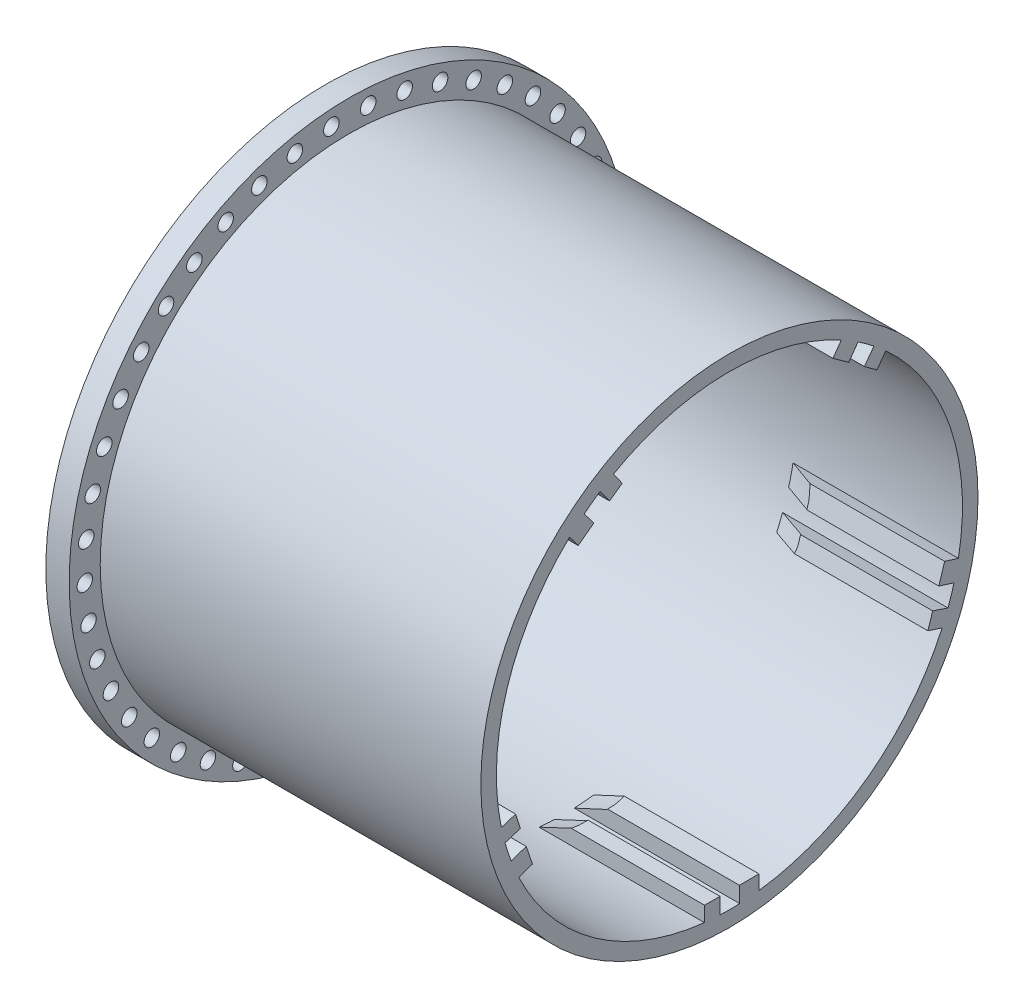
from build123d import *

# Parameters (mm, degrees)
SKETCH1_R           = 36
SKETCH1_R_2         = 1
SKETCH1_R_3         = 4.25
BOSS_EXTRUDE1_DEPTH = 3
SKETCH2_R           = 32
BOSS_EXTRUDE4_DEPTH = 49
SKETCH1_7_R         = 30
CUT_EXTRUDE3_DEPTH  = 3
CUT_EXTRUDE4_START  = -17
SKETCH3_R           = 30
CUT_EXTRUDE4_DEPTH  = 56.773621595
CHAMFER2_SIZE       = 4.289013841
CHAMFER2_SIZE_2     = 2


with BuildPart() as part:
    # Sketch1 → Boss-Extrude1 (new body)
    with BuildSketch(Plane(origin=(0, 0, 0), x_dir=(0, 0, -1), z_dir=(1, 0, 0))):
        Circle(SKETCH1_R)
        with Locations((20.089039043, 27.430466826)):
            Circle(SKETCH1_R_2, mode=Mode.SUBTRACT)
        with Locations((23.711117025, 24.36766155)):
            Circle(SKETCH1_R_2, mode=Mode.SUBTRACT)
        with Locations((26.871685085, 20.830567459)):
            Circle(SKETCH1_R_2, mode=Mode.SUBTRACT)
        with Locations((29.509226361, 16.888030067)):
            Circle(SKETCH1_R_2, mode=Mode.SUBTRACT)
        with Locations((31.572404113, 12.61678638)):
            Circle(SKETCH1_R_2, mode=Mode.SUBTRACT)
        with Locations((33.021060931, 8.099971297)):
            Circle(SKETCH1_R_2, mode=Mode.SUBTRACT)
        with Locations((33.827000359, 3.425499486)):
            Circle(SKETCH1_R_2, mode=Mode.SUBTRACT)
        with Locations((33.974535702, -1.315645775)):
            Circle(SKETCH1_R_2, mode=Mode.SUBTRACT)
        with Locations((33.460795354, -6.031183488)):
            Circle(SKETCH1_R_2, mode=Mode.SUBTRACT)
        with Locations((32.295778685, -10.629331075)):
            Circle(SKETCH1_R_2, mode=Mode.SUBTRACT)
        with Locations((30.50216142, -15.020590824)):
            Circle(SKETCH1_R_2, mode=Mode.SUBTRACT)
        with Locations((28.114854279, -19.119491857)):
            Circle(SKETCH1_R_2, mode=Mode.SUBTRACT)
        with Locations((25.180323479, -22.84625373)):
            Circle(SKETCH1_R_2, mode=Mode.SUBTRACT)
        with Locations((21.755686325, -26.128339261)):
            Circle(SKETCH1_R_2, mode=Mode.SUBTRACT)
        with Locations((17.907599484, -28.901866388)):
            Circle(SKETCH1_R_2, mode=Mode.SUBTRACT)
        with Locations((13.710961588, -31.112851562)):
            Circle(SKETCH1_R_2, mode=Mode.SUBTRACT)
        with Locations((9.24745542, -32.718260471)):
            Circle(SKETCH1_R_2, mode=Mode.SUBTRACT)
        with Locations((4.603958052, -33.686845656)):
            Circle(SKETCH1_R_2, mode=Mode.SUBTRACT)
        with Locations((-0.129150123, -33.999754709)):
            Circle(SKETCH1_R_2, mode=Mode.SUBTRACT)
        with Locations((-4.859744537, -33.65089721)):
            Circle(SKETCH1_R_2, mode=Mode.SUBTRACT)
        with Locations((-9.495749552, -32.647063274)):
            Circle(SKETCH1_R_2, mode=Mode.SUBTRACT)
        with Locations((-13.946930604, -31.007791388)):
            Circle(SKETCH1_R_2, mode=Mode.SUBTRACT)
        with Locations((-18.126650515, -28.764988112)):
            Circle(SKETCH1_R_2, mode=Mode.SUBTRACT)
        with Locations((-21.953555793, -25.962307063)):
            Circle(SKETCH1_R_2, mode=Mode.SUBTRACT)
        with Locations((-25.353160079, -22.654299239)):
            Circle(SKETCH1_R_2, mode=Mode.SUBTRACT)
        with Locations((-28.259293943, -18.905351249)):
            Circle(SKETCH1_R_2, mode=Mode.SUBTRACT)
        with Locations((-30.615392795, -14.788432101)):
            Circle(SKETCH1_R_2, mode=Mode.SUBTRACT)
        with Locations((-32.375597851, -10.383672944)):
            Circle(SKETCH1_R_2, mode=Mode.SUBTRACT)
        with Locations((-33.505648721, -5.776807404)):
            Circle(SKETCH1_R_2, mode=Mode.SUBTRACT)
        with Locations((-33.983550251, -1.057502879)):
            Circle(SKETCH1_R_2, mode=Mode.SUBTRACT)
        with Locations((-33.800000631, 3.682384736)):
            Circle(SKETCH1_R_2, mode=Mode.SUBTRACT)
        with Locations((-32.958572446, 8.350598921)):
            Circle(SKETCH1_R_2, mode=Mode.SUBTRACT)
        with Locations((-31.475643138, 12.856278197)):
            Circle(SKETCH1_R_2, mode=Mode.SUBTRACT)
        with Locations((-29.380076239, 17.111724641)):
            Circle(SKETCH1_R_2, mode=Mode.SUBTRACT)
        with Locations((-26.712659575, 21.03411083)):
            Circle(SKETCH1_R_2, mode=Mode.SUBTRACT)
        with Locations((-23.525311378, 24.547091977)):
            Circle(SKETCH1_R_2, mode=Mode.SUBTRACT)
        with Locations((-19.880069755, 27.582291901)):
            Circle(SKETCH1_R_2, mode=Mode.SUBTRACT)
        with Locations((-15.847885187, 30.080633888)):
            Circle(SKETCH1_R_2, mode=Mode.SUBTRACT)
        with Locations((-11.507239561, 31.993490552)):
            Circle(SKETCH1_R_2, mode=Mode.SUBTRACT)
        with Locations((-6.942618606, 33.283630314)):
            Circle(SKETCH1_R_2, mode=Mode.SUBTRACT)
        with Locations((-2.242867477, 33.925942072)):
            Circle(SKETCH1_R_2, mode=Mode.SUBTRACT)
        with Locations((2.500538516, 33.907923958)):
            Circle(SKETCH1_R_2, mode=Mode.SUBTRACT)
        with Locations((7.195274371, 33.229926673)):
            Circle(SKETCH1_R_2, mode=Mode.SUBTRACT)
        with Locations((11.749962396, 31.905146665)):
            Circle(SKETCH1_R_2, mode=Mode.SUBTRACT)
        with Locations((16.075950767, 29.959369268)):
            Circle(SKETCH1_R_2, mode=Mode.SUBTRACT)
        Circle(SKETCH1_R_3, mode=Mode.SUBTRACT)
    extrude(amount=BOSS_EXTRUDE1_DEPTH)

    # Sketch2 → Boss-Extrude4 (add)
    with BuildSketch(Plane(origin=(3, 0, 0), x_dir=(0, 0, -1), z_dir=(1, 0, 0))):
        Circle(SKETCH2_R)
        with BuildLine():
            ThreePointArc((3.814407208, -29.756516894), (17.876251009, -24.092315162), (27.373321967, -12.276043519))
            Line((27.373321967, -12.276043519), (25.537181456, -11.665738199))
            Line((25.537181456, -11.665738199), (26.168016669, -9.767832265))
            Line((26.168016669, -9.767832265), (28.13201636, -10.420636042))
            ThreePointArc((28.13201636, -10.420636042), (28.546970251, -9.223366495), (28.910995043, -8.009642041))
            Line((28.910995043, -8.009642041), (26.956560685, -7.395449847))
            Line((26.956560685, -7.395449847), (27.70606209, -5.0104451))
            Line((27.70606209, -5.0104451), (29.478845945, -5.567552583))
            ThreePointArc((29.478845945, -5.567552583), (28.437218685, 9.55639019), (20.134032864, 22.240070158))
            Line((20.134032864, 22.240070158), (18.98619939, 20.682391476))
            Line((18.98619939, 20.682391476), (17.376122385, 21.868836603))
            Line((17.376122385, 21.868836603), (18.603884953, 23.534983846))
            ThreePointArc((18.603884953, 23.534983846), (17.593441753, 24.299605085), (16.551611049, 25.020874719))
            Line((16.551611049, 25.020874719), (15.363526129, 23.351893012))
            Line((15.363526129, 23.351893012), (13.326860495, 24.801718206))
            Line((13.326860495, 24.801718206), (14.404521535, 26.315580164))
            ThreePointArc((14.404521535, 26.315580164), (-0.301083316, 29.998489109), (-14.929805327, 26.021162789))
            Line((-14.929805327, 26.021162789), (-13.803064916, 24.4481591))
            Line((-13.803064916, 24.4481591), (-15.428982442, 23.28351658))
            Line((-15.428982442, 23.28351658), (-16.634183136, 24.966055984))
            ThreePointArc((-16.634183136, 24.966055984), (-17.673625268, 24.241348351), (-18.681536846, 23.473393045))
            Line((-18.681536846, 23.473393045), (-17.46137935, 21.82771343))
            Line((-17.46137935, 21.82771343), (-19.469609341, 20.338749931))
            Line((-19.469609341, 20.338749931), (-20.576362045, 21.831475557))
            ThreePointArc((-20.576362045, 21.831475557), (-28.623298408, 8.983695691), (-29.361160001, -6.158107128))
            Line((-29.361160001, -6.158107128), (-27.516962657, -5.57259819))
            Line((-27.516962657, -5.57259819), (-26.911757946, -7.478831979))
            Line((-26.911757946, -7.478831979), (-28.884375506, -8.105112683))
            ThreePointArc((-28.884375506, -8.105112683), (-28.516342873, -9.317627871), (-28.097435782, -10.513519985))
            Line((-28.097435782, -10.513519985), (-26.155252058, -9.861624216))
            Line((-26.155252058, -9.861624216), (-25.359740815, -12.23167946))
            Line((-25.359740815, -12.23167946), (-27.121412643, -12.822986245))
            ThreePointArc((-27.121412643, -12.822986245), (-17.38908797, -24.446259828), (-3.216389503, -29.827082301))
            Line((-3.216389503, -29.827082301), (-3.203353273, -27.892214187))
            Line((-3.203353273, -27.892214187), (-1.203398666, -27.905688939))
            Line((-1.203398666, -27.905688939), (-1.217342671, -29.975291105))
            ThreePointArc((-1.217342671, -29.975291105), (0.049556138, -29.99995907), (1.316366536, -29.971105738))
            Line((1.316366536, -29.971105738), (1.296544593, -27.92253238))
            Line((1.296544593, -27.92253238), (3.796427571, -27.898343577))
            Line((3.796427571, -27.898343577), (3.814407208, -29.756516894))
        make_face(mode=Mode.SUBTRACT)
    extrude(amount=BOSS_EXTRUDE4_DEPTH)

    # Sketch1<7> → Cut-Extrude3 (cut)
    with BuildSketch(Plane(origin=(0, 0, 0), x_dir=(0, 0, -1), z_dir=(1, 0, 0))):
        with Locations(Location((0, 0, 0), (0, 0, 191.845318953))):
            Circle(SKETCH1_7_R)
    extrude(amount=CUT_EXTRUDE3_DEPTH, mode=Mode.SUBTRACT)

    # Sketch3 → Cut-Extrude4 (cut, through all)
    with BuildSketch(Plane(origin=(52, 0, 0), x_dir=(0, 0, -1), z_dir=(1, 0, 0)).offset(CUT_EXTRUDE4_START)):
        with Locations(Location((0, 0, 0), (0, 0, 191.845318953))):
            Circle(SKETCH3_R)
    extrude(amount=-CUT_EXTRUDE4_DEPTH, mode=Mode.SUBTRACT)

    # Chamfer2
    # the kernel refuses this chamfer: 4.289013841, 2 mm, written as the material it adds along each edge
    with BuildSketch(Plane(origin=(35, 0, 0), x_dir=(0, -0.9471605084793957, 0.3207599899879229), z_dir=(0, 0.3207599899879229, 0.9471605084793957))) as chamfer2_piece_1_section:
        Polygon((30, -CHAMFER2_SIZE), (30 - CHAMFER2_SIZE_2, 0), (30, 0), align=None)
    chamfer2_piece_1 = revolve(axis=Axis((35, 0, 0), (1, 0, 0)), revolution_arc=47.237420401, mode=Mode.PRIVATE)
    chamfer2_piece_1 = split(chamfer2_piece_1, bisect_by=Plane(origin=(33.540854051, -27.956601206, 2.224426607), z_dir=(0, -0.9999531910488229, -0.009675521240562588)), keep=Keep.TOP, mode=Mode.PRIVATE)
    chamfer2_piece_1 = split(chamfer2_piece_1, bisect_by=Plane(origin=(33.540854051, -29.29435355, 1.212754834), z_dir=(0, 0.006737376227867174, 0.9999773036232193)), keep=Keep.TOP, mode=Mode.PRIVATE)
    chamfer2_piece_1 = split(chamfer2_piece_1, bisect_by=Plane(origin=(33.540854051, -29.280878798, 3.212709441), z_dir=(0, -0.006737376227861118, -0.9999773036232195)), keep=Keep.TOP, mode=Mode.PRIVATE)
    add(chamfer2_piece_1)
    with BuildSketch(Plane(origin=(35, 0, 0), x_dir=(0, -0.9471605084793957, 0.3207599899879229), z_dir=(0, 0.3207599899879229, 0.9471605084793957))) as chamfer2_piece_2_section:
        Polygon((30, -CHAMFER2_SIZE), (30 - CHAMFER2_SIZE_2, 0), (30, 0), align=None)
    chamfer2_piece_2 = revolve(axis=Axis((35, 0, 0), (1, 0, 0)), revolution_arc=47.237420401, mode=Mode.PRIVATE)
    chamfer2_piece_2 = split(chamfer2_piece_2, bisect_by=Plane(origin=(35.059461893, -27.959086514, 2.481280129), z_dir=(0, 0.9999531910488229, 0.009675521240562588)), keep=Keep.TOP, mode=Mode.PRIVATE)
    chamfer2_piece_2 = split(chamfer2_piece_2, bisect_by=Plane(origin=(35.059461893, -27.938747432, 1.203621398), z_dir=(0, 0.006737376227867174, 0.9999773036232193)), keep=Keep.TOP, mode=Mode.PRIVATE)
    chamfer2_piece_2 = split(chamfer2_piece_2, bisect_by=Plane(origin=(35.059461893, -27.92527268, 3.203576005), z_dir=(0, -0.006737376227861118, -0.9999773036232195)), keep=Keep.TOP, mode=Mode.PRIVATE)
    chamfer2_piece_2 = split(chamfer2_piece_2, bisect_by=Plane(origin=(35.059461893, -27.897078789, 2.481337509), z_dir=(0, -0.9999773036232195, 0.0067373762278606295)), keep=Keep.TOP, mode=Mode.PRIVATE)
    add(chamfer2_piece_2)
    with BuildSketch(Plane(origin=(35, 0, 0), x_dir=(0, -0.9471605084793957, 0.3207599899879229), z_dir=(0, 0.3207599899879229, 0.9471605084793957))) as chamfer2_piece_3_section:
        Polygon((30, -CHAMFER2_SIZE), (30 - CHAMFER2_SIZE_2, 0), (30, 0), align=None)
    chamfer2_piece_3 = revolve(axis=Axis((35, 0, 0), (1, 0, 0)), revolution_arc=47.237420401, mode=Mode.PRIVATE)
    chamfer2_piece_3 = split(chamfer2_piece_3, bisect_by=Plane(origin=(33.539564686, -29.24525833, -3.809460283), z_dir=(0, -0.009675521240564857, 0.9999531910488229)), keep=Keep.TOP, mode=Mode.PRIVATE)
    chamfer2_piece_3 = split(chamfer2_piece_3, bisect_by=Plane(origin=(33.539564686, -29.269447133, -1.309577306), z_dir=(0, 0.009675521240554133, -0.9999531910488229)), keep=Keep.TOP, mode=Mode.PRIVATE)
    chamfer2_piece_3 = split(chamfer2_piece_3, bisect_by=Plane(origin=(33.539564686, -27.931087014, -2.566243676), z_dir=(0, -0.9999773036232195, 0.0067373762278606295)), keep=Keep.TOP, mode=Mode.PRIVATE)
    add(chamfer2_piece_3)
    with BuildSketch(Plane(origin=(35, 0, 0), x_dir=(0, -0.9471605084793957, 0.3207599899879229), z_dir=(0, 0.3207599899879229, 0.9471605084793957))) as chamfer2_piece_4_section:
        Polygon((30, -CHAMFER2_SIZE), (30 - CHAMFER2_SIZE_2, 0), (30, 0), align=None)
    chamfer2_piece_4 = revolve(axis=Axis((35, 0, 0), (1, 0, 0)), revolution_arc=47.237420401, mode=Mode.PRIVATE)
    chamfer2_piece_4 = split(chamfer2_piece_4, bisect_by=Plane(origin=(34.994576269, -27.913778513, -3.796576919), z_dir=(0, -0.009675521240564857, 0.9999531910488229)), keep=Keep.TOP, mode=Mode.PRIVATE)
    chamfer2_piece_4 = split(chamfer2_piece_4, bisect_by=Plane(origin=(34.994576269, -27.904749848, -3.134347345), z_dir=(0, -0.9999531910488229, -0.009675521240562588)), keep=Keep.TOP, mode=Mode.PRIVATE)
    chamfer2_piece_4 = split(chamfer2_piece_4, bisect_by=Plane(origin=(34.994576269, -27.934914967, -3.134397448), z_dir=(0, 0.9999773036232195, -0.0067373762278606295)), keep=Keep.TOP, mode=Mode.PRIVATE)
    add(chamfer2_piece_4)
    with BuildSketch(Plane(origin=(35, 0, 0), x_dir=(0, 0.012372185123805581, 0.9999234615885669), z_dir=(0, 0.9999234615885669, -0.012372185123805581))) as chamfer2_piece_5_section:
        Polygon((30, -CHAMFER2_SIZE), (30 - CHAMFER2_SIZE_2, 0), (30, 0), align=None)
    chamfer2_piece_5 = revolve(axis=Axis((35, 0, 0), (1, 0, 0)), revolution_arc=47.237420401, mode=Mode.PRIVATE)
    chamfer2_piece_5 = split(chamfer2_piece_5, bisect_by=Plane(origin=(33.540854051, -6.523509458, 27.275693375), z_dir=(0, -0.3182044971379357, 0.9480220978443453)), keep=Keep.TOP, mode=Mode.PRIVATE)
    chamfer2_piece_5 = split(chamfer2_piece_5, bisect_by=Plane(origin=(33.540854051, -7.899054699, 28.235347688), z_dir=(0, 0.9531168945100278, 0.3026023552445694)), keep=Keep.TOP, mode=Mode.PRIVATE)
    chamfer2_piece_5 = split(chamfer2_piece_5, bisect_by=Plane(origin=(33.540854051, -5.99282091, 28.840552399), z_dir=(0, -0.9531168945100277, -0.3026023552445699)), keep=Keep.TOP, mode=Mode.PRIVATE)
    add(chamfer2_piece_5)
    with BuildSketch(Plane(origin=(35, 0, 0), x_dir=(0, 0.012372185123805581, 0.9999234615885669), z_dir=(0, 0.9999234615885669, -0.012372185123805581))) as chamfer2_piece_6_section:
        Polygon((30, -CHAMFER2_SIZE), (30 - CHAMFER2_SIZE_2, 0), (30, 0), align=None)
    chamfer2_piece_6 = revolve(axis=Axis((35, 0, 0), (1, 0, 0)), revolution_arc=47.237420401, mode=Mode.PRIVATE)
    chamfer2_piece_6 = split(chamfer2_piece_6, bisect_by=Plane(origin=(35.059461893, -6.279995244, 27.357429147), z_dir=(0, 0.3182044971379357, -0.9480220978443453)), keep=Keep.TOP, mode=Mode.PRIVATE)
    chamfer2_piece_6 = split(chamfer2_piece_6, bisect_by=Plane(origin=(35.059461893, -7.488835784, 26.943267269), z_dir=(0, 0.9531168945100278, 0.3026023552445694)), keep=Keep.TOP, mode=Mode.PRIVATE)
    chamfer2_piece_6 = split(chamfer2_piece_6, bisect_by=Plane(origin=(35.059461893, -5.582601995, 27.54847198), z_dir=(0, -0.9531168945100277, -0.3026023552445699)), keep=Keep.TOP, mode=Mode.PRIVATE)
    chamfer2_piece_6 = split(chamfer2_piece_6, bisect_by=Plane(origin=(35.059461893, -6.260779232, 27.298474027), z_dir=(0, -0.30260235524456996, 0.9531168945100277)), keep=Keep.TOP, mode=Mode.PRIVATE)
    add(chamfer2_piece_6)
    with BuildSketch(Plane(origin=(35, 0, 0), x_dir=(0, 0.012372185123805581, 0.9999234615885669), z_dir=(0, 0.9999234615885669, -0.012372185123805581))) as chamfer2_piece_7_section:
        Polygon((30, -CHAMFER2_SIZE), (30 - CHAMFER2_SIZE_2, 0), (30, 0), align=None)
    chamfer2_piece_7 = revolve(axis=Axis((35, 0, 0), (1, 0, 0)), revolution_arc=47.237420401, mode=Mode.PRIVATE)
    chamfer2_piece_7 = split(chamfer2_piece_7, bisect_by=Plane(origin=(33.539564686, -12.660293855, 26.636705539), z_dir=(0, 0.9480220978443453, 0.3182044971379361)), keep=Keep.TOP, mode=Mode.PRIVATE)
    chamfer2_piece_7 = split(chamfer2_piece_7, bisect_by=Plane(origin=(33.539564686, -10.29023861, 27.432216781), z_dir=(0, -0.9480220978443462, -0.31820449713793325)), keep=Keep.TOP, mode=Mode.PRIVATE)
    chamfer2_piece_7 = split(chamfer2_piece_7, bisect_by=Plane(origin=(33.539564686, -11.071823329, 25.771029405), z_dir=(0, -0.30260235524456996, 0.9531168945100277)), keep=Keep.TOP, mode=Mode.PRIVATE)
    add(chamfer2_piece_7)
    with BuildSketch(Plane(origin=(35, 0, 0), x_dir=(0, 0.012372185123805581, 0.9999234615885669), z_dir=(0, 0.9999234615885669, -0.012372185123805581))) as chamfer2_piece_8_section:
        Polygon((30, -CHAMFER2_SIZE), (30 - CHAMFER2_SIZE_2, 0), (30, 0), align=None)
    chamfer2_piece_8 = revolve(axis=Axis((35, 0, 0), (1, 0, 0)), revolution_arc=47.237420401, mode=Mode.PRIVATE)
    chamfer2_piece_8 = split(chamfer2_piece_8, bisect_by=Plane(origin=(34.994576269, -12.236591156, 25.37437416), z_dir=(0, 0.9480220978443453, 0.3182044971379361)), keep=Keep.TOP, mode=Mode.PRIVATE)
    chamfer2_piece_8 = split(chamfer2_piece_8, bisect_by=Plane(origin=(34.994576269, -11.603983394, 25.570427582), z_dir=(0, -0.3182044971379357, 0.9480220978443453)), keep=Keep.TOP, mode=Mode.PRIVATE)
    chamfer2_piece_8 = split(chamfer2_piece_8, bisect_by=Plane(origin=(34.994576269, -11.613352579, 25.599100833), z_dir=(0, 0.30260235524456996, -0.9531168945100277)), keep=Keep.TOP, mode=Mode.PRIVATE)
    add(chamfer2_piece_8)
    with BuildSketch(Plane(origin=(35, 0, 0), x_dir=(0, 0.9548069394010322, 0.2972266954222545), z_dir=(0, 0.2972266954222545, -0.9548069394010322))) as chamfer2_piece_9_section:
        Polygon((30, -CHAMFER2_SIZE), (30 - CHAMFER2_SIZE_2, 0), (30, 0), align=None)
    chamfer2_piece_9 = revolve(axis=Axis((35, 0, 0), (1, 0, 0)), revolution_arc=47.237420401, mode=Mode.PRIVATE)
    chamfer2_piece_9 = split(chamfer2_piece_9, bisect_by=Plane(origin=(33.540854051, 23.924850635, 14.632878965), z_dir=(0, 0.8032919964445093, 0.5955853997943489)), keep=Keep.TOP, mode=Mode.PRIVATE)
    chamfer2_piece_9 = split(chamfer2_piece_9, bisect_by=Plane(origin=(33.540854051, 25.577111787, 14.611732196), z_dir=(0, -0.5823212598310848, 0.812958763006303)), keep=Keep.TOP, mode=Mode.PRIVATE)
    chamfer2_piece_9 = split(chamfer2_piece_9, bisect_by=Plane(origin=(33.540854051, 24.412469268, 16.237649722), z_dir=(0, 0.5823212598310827, -0.8129587630063045)), keep=Keep.TOP, mode=Mode.PRIVATE)
    add(chamfer2_piece_9)
    with BuildSketch(Plane(origin=(35, 0, 0), x_dir=(0, 0.9548069394010322, 0.2972266954222545), z_dir=(0, 0.2972266954222545, -0.9548069394010322))) as chamfer2_piece_10_section:
        Polygon((30, -CHAMFER2_SIZE), (30 - CHAMFER2_SIZE_2, 0), (30, 0), align=None)
    chamfer2_piece_10 = revolve(axis=Axis((35, 0, 0), (1, 0, 0)), revolution_arc=47.237420401, mode=Mode.PRIVATE)
    chamfer2_piece_10 = split(chamfer2_piece_10, bisect_by=Plane(origin=(35.059461893, 24.077836004, 14.426540928), z_dir=(0, -0.8032919964445093, -0.5955853997943489)), keep=Keep.TOP, mode=Mode.PRIVATE)
    chamfer2_piece_10 = split(chamfer2_piece_10, bisect_by=Plane(origin=(35.059461893, 24.475034901, 13.822316016), z_dir=(0, -0.5823212598310848, 0.812958763006303)), keep=Keep.TOP, mode=Mode.PRIVATE)
    chamfer2_piece_10 = split(chamfer2_piece_10, bisect_by=Plane(origin=(35.059461893, 24.027704427, 14.390047281), z_dir=(0, 0.8129587630063031, 0.5823212598310847)), keep=Keep.TOP, mode=Mode.PRIVATE)
    chamfer2_piece_10 = split(chamfer2_piece_10, bisect_by=Plane(origin=(35.059461893, 23.310392381, 15.448233542), z_dir=(0, 0.5823212598310827, -0.8129587630063045)), keep=Keep.TOP, mode=Mode.PRIVATE)
    add(chamfer2_piece_10)
    with BuildSketch(Plane(origin=(35, 0, 0), x_dir=(0, 0.9548069394010322, 0.2972266954222545), z_dir=(0, 0.2972266954222545, -0.9548069394010322))) as chamfer2_piece_11_section:
        Polygon((30, -CHAMFER2_SIZE), (30 - CHAMFER2_SIZE_2, 0), (30, 0), align=None)
    chamfer2_piece_11 = revolve(axis=Axis((35, 0, 0), (1, 0, 0)), revolution_arc=47.237420401, mode=Mode.PRIVATE)
    chamfer2_piece_11 = split(chamfer2_piece_11, bisect_by=Plane(origin=(33.539564686, 21.42076642, 20.271849655), z_dir=(0, 0.5955853997943487, -0.8032919964445098)), keep=Keep.TOP, mode=Mode.PRIVATE)
    chamfer2_piece_11 = split(chamfer2_piece_11, bisect_by=Plane(origin=(33.539564686, 22.90972992, 18.263619663), z_dir=(0, -0.5955853997943481, 0.80329199644451)), keep=Keep.TOP, mode=Mode.PRIVATE)
    chamfer2_piece_11 = split(chamfer2_piece_11, bisect_by=Plane(origin=(33.539564686, 21.088323879, 18.493615773), z_dir=(0, 0.8129587630063031, 0.5823212598310847)), keep=Keep.TOP, mode=Mode.PRIVATE)
    add(chamfer2_piece_11)
    with BuildSketch(Plane(origin=(35, 0, 0), x_dir=(0, 0.9548069394010322, 0.2972266954222545), z_dir=(0, 0.2972266954222545, -0.9548069394010322))) as chamfer2_piece_12_section:
        Polygon((30, -CHAMFER2_SIZE), (30 - CHAMFER2_SIZE_2, 0), (30, 0), align=None)
    chamfer2_piece_12 = revolve(axis=Axis((35, 0, 0), (1, 0, 0)), revolution_arc=47.237420401, mode=Mode.PRIVATE)
    chamfer2_piece_12 = split(chamfer2_piece_12, bisect_by=Plane(origin=(34.994576269, 20.351149272, 19.478802594), z_dir=(0, 0.5955853997943487, -0.8032919964445098)), keep=Keep.TOP, mode=Mode.PRIVATE)
    chamfer2_piece_12 = split(chamfer2_piece_12, bisect_by=Plane(origin=(34.994576269, 20.733093706, 18.937740698), z_dir=(0, 0.8032919964445093, 0.5955853997943489)), keep=Keep.TOP, mode=Mode.PRIVATE)
    chamfer2_piece_12 = split(chamfer2_piece_12, bisect_by=Plane(origin=(34.994576269, 20.75746835, 18.955511844), z_dir=(0, -0.8129587630063031, -0.5823212598310847)), keep=Keep.TOP, mode=Mode.PRIVATE)
    add(chamfer2_piece_12)
    with BuildSketch(Plane(origin=(35, 0, 0), x_dir=(0, 0.5777309561202609, -0.8162272614537994), z_dir=(0, -0.8162272614537994, -0.5777309561202609))) as chamfer2_piece_13_section:
        Polygon((30, -CHAMFER2_SIZE), (30 - CHAMFER2_SIZE_2, 0), (30, 0), align=None)
    chamfer2_piece_13 = revolve(axis=Axis((35, 0, 0), (1, 0, 0)), revolution_arc=47.237420401, mode=Mode.PRIVATE)
    chamfer2_piece_13 = split(chamfer2_piece_13, bisect_by=Plane(origin=(33.540854051, 21.309880326, -18.232076821), z_dir=(0, 0.814666253831402, -0.5799300775682442)), keep=Keep.TOP, mode=Mode.PRIVATE)
    chamfer2_piece_13 = split(chamfer2_piece_13, bisect_by=Plane(origin=(33.540854051, 21.800345328, -19.810005268), z_dir=(0, 0.5932225635627563, 0.8050385022345401)), keep=Keep.TOP, mode=Mode.PRIVATE)
    chamfer2_piece_13 = split(chamfer2_piece_13, bisect_by=Plane(origin=(33.540854051, 22.986790455, -18.199928263), z_dir=(0, -0.5932225635627612, -0.8050385022345365)), keep=Keep.TOP, mode=Mode.PRIVATE)
    add(chamfer2_piece_13)
    with BuildSketch(Plane(origin=(35, 0, 0), x_dir=(0, 0.5777309561202609, -0.8162272614537994), z_dir=(0, -0.8162272614537994, -0.5777309561202609))) as chamfer2_piece_14_section:
        Polygon((30, -CHAMFER2_SIZE), (30 - CHAMFER2_SIZE_2, 0), (30, 0), align=None)
    chamfer2_piece_14 = revolve(axis=Axis((35, 0, 0), (1, 0, 0)), revolution_arc=47.237420401, mode=Mode.PRIVATE)
    chamfer2_piece_14 = split(chamfer2_piece_14, bisect_by=Plane(origin=(35.059461893, 21.16091627, -18.441336513), z_dir=(0, -0.814666253831402, 0.5799300775682442)), keep=Keep.TOP, mode=Mode.PRIVATE)
    chamfer2_piece_14 = split(chamfer2_piece_14, bisect_by=Plane(origin=(35.059461893, 20.70900544, -19.005810879), z_dir=(0, 0.5932225635627563, 0.8050385022345401)), keep=Keep.TOP, mode=Mode.PRIVATE)
    chamfer2_piece_14 = split(chamfer2_piece_14, bisect_by=Plane(origin=(35.059461893, 21.11071724, -18.404935708), z_dir=(0, 0.8050385022345392, -0.5932225635627576)), keep=Keep.TOP, mode=Mode.PRIVATE)
    chamfer2_piece_14 = split(chamfer2_piece_14, bisect_by=Plane(origin=(35.059461893, 21.895450567, -17.395733874), z_dir=(0, -0.5932225635627612, -0.8050385022345365)), keep=Keep.TOP, mode=Mode.PRIVATE)
    add(chamfer2_piece_14)
    with BuildSketch(Plane(origin=(35, 0, 0), x_dir=(0, 0.5777309561202609, -0.8162272614537994), z_dir=(0, -0.8162272614537994, -0.5777309561202609))) as chamfer2_piece_15_section:
        Polygon((30, -CHAMFER2_SIZE), (30 - CHAMFER2_SIZE_2, 0), (30, 0), align=None)
    chamfer2_piece_15 = revolve(axis=Axis((35, 0, 0), (1, 0, 0)), revolution_arc=47.237420401, mode=Mode.PRIVATE)
    chamfer2_piece_15 = split(chamfer2_piece_15, bisect_by=Plane(origin=(33.539564686, 25.899055568, -14.108013437), z_dir=(0, -0.579930077568244, -0.8146662538314022)), keep=Keep.TOP, mode=Mode.PRIVATE)
    chamfer2_piece_15 = split(chamfer2_piece_15, bisect_by=Plane(origin=(33.539564686, 24.449230374, -16.144679072), z_dir=(0, 0.5799300775682479, 0.8146662538313995)), keep=Keep.TOP, mode=Mode.PRIVATE)
    chamfer2_piece_15 = split(chamfer2_piece_15, bisect_by=Plane(origin=(33.539564686, 24.105124253, -14.341346282), z_dir=(0, 0.8050385022345392, -0.5932225635627576)), keep=Keep.TOP, mode=Mode.PRIVATE)
    add(chamfer2_piece_15)
    with BuildSketch(Plane(origin=(35, 0, 0), x_dir=(0, 0.5777309561202609, -0.8162272614537994), z_dir=(0, -0.8162272614537994, -0.5777309561202609))) as chamfer2_piece_16_section:
        Polygon((30, -CHAMFER2_SIZE), (30 - CHAMFER2_SIZE_2, 0), (30, 0), align=None)
    chamfer2_piece_16 = revolve(axis=Axis((35, 0, 0), (1, 0, 0)), revolution_arc=47.237420401, mode=Mode.PRIVATE)
    chamfer2_piece_16 = split(chamfer2_piece_16, bisect_by=Plane(origin=(34.994576268, 24.814293116, -13.335812097), z_dir=(0, -0.579930077568244, -0.8146662538314022)), keep=Keep.TOP, mode=Mode.PRIVATE)
    chamfer2_piece_16 = split(chamfer2_piece_16, bisect_by=Plane(origin=(34.994576268, 24.417739996, -13.86626016), z_dir=(0, 0.814666253831402, -0.5799300775682442)), keep=Keep.TOP, mode=Mode.PRIVATE)
    chamfer2_piece_16 = split(chamfer2_piece_16, bisect_by=Plane(origin=(34.994576268, 24.44217354, -13.883950238), z_dir=(0, -0.8050385022345392, 0.5932225635627576)), keep=Keep.TOP, mode=Mode.PRIVATE)
    add(chamfer2_piece_16)
    with BuildSketch(Plane(origin=(35, 0, 0), x_dir=(0, -0.5977495721657248, -0.8016828855449597), z_dir=(0, -0.8016828855449597, 0.5977495721657248))) as chamfer2_piece_17_section:
        Polygon((30, -CHAMFER2_SIZE), (30 - CHAMFER2_SIZE_2, 0), (30, 0), align=None)
    chamfer2_piece_17 = revolve(axis=Axis((35, 0, 0), (1, 0, 0)), revolution_arc=47.237420401, mode=Mode.PRIVATE)
    chamfer2_piece_17 = split(chamfer2_piece_17, bisect_by=Plane(origin=(33.540854051, -10.754620298, -25.900922126), z_dir=(0, -0.299800562089155, -0.9540018988298854)), keep=Keep.TOP, mode=Mode.PRIVATE)
    chamfer2_piece_17 = split(chamfer2_piece_17, bisect_by=Plane(origin=(33.540854051, -10.205851474, -27.485823981), z_dir=(0, -0.9489529670062141, 0.31541760637304833)), keep=Keep.TOP, mode=Mode.PRIVATE)
    chamfer2_piece_17 = split(chamfer2_piece_17, bisect_by=Plane(origin=(33.540854051, -12.103757408, -26.854988768), z_dir=(0, 0.9489529670062131, -0.31541760637305116)), keep=Keep.TOP, mode=Mode.PRIVATE)
    add(chamfer2_piece_17)
    with BuildSketch(Plane(origin=(35, 0, 0), x_dir=(0, -0.5977495721657248, -0.8016828855449597), z_dir=(0, -0.8016828855449597, 0.5977495721657248))) as chamfer2_piece_18_section:
        Polygon((30, -CHAMFER2_SIZE), (30 - CHAMFER2_SIZE_2, 0), (30, 0), align=None)
    chamfer2_piece_18 = revolve(axis=Axis((35, 0, 0), (1, 0, 0)), revolution_arc=47.237420401, mode=Mode.PRIVATE)
    chamfer2_piece_18 = split(chamfer2_piece_18, bisect_by=Plane(origin=(35.059461893, -10.999670516, -25.823913691), z_dir=(0, 0.299800562089155, 0.9540018988298854)), keep=Keep.TOP, mode=Mode.PRIVATE)
    chamfer2_piece_18 = split(chamfer2_piece_18, bisect_by=Plane(origin=(35.059461893, -9.778259732, -26.199388336), z_dir=(0, -0.9489529670062141, 0.31541760637304833)), keep=Keep.TOP, mode=Mode.PRIVATE)
    chamfer2_piece_18 = split(chamfer2_piece_18, bisect_by=Plane(origin=(35.059461893, -11.676165666, -25.568553123), z_dir=(0, 0.9489529670062131, -0.31541760637305116)), keep=Keep.TOP, mode=Mode.PRIVATE)
    chamfer2_piece_18 = split(chamfer2_piece_18, bisect_by=Plane(origin=(35.059461893, -10.980563646, -25.764923109), z_dir=(0, -0.3154176063730516, -0.948952967006213)), keep=Keep.TOP, mode=Mode.PRIVATE)
    add(chamfer2_piece_18)
    with BuildSketch(Plane(origin=(35, 0, 0), x_dir=(0, -0.5977495721657248, -0.8016828855449597), z_dir=(0, -0.8016828855449597, 0.5977495721657248))) as chamfer2_piece_19_section:
        Polygon((30, -CHAMFER2_SIZE), (30 - CHAMFER2_SIZE_2, 0), (30, 0), align=None)
    chamfer2_piece_19 = revolve(axis=Axis((35, 0, 0), (1, 0, 0)), revolution_arc=47.237420401, mode=Mode.PRIVATE)
    chamfer2_piece_19 = split(chamfer2_piece_19, bisect_by=Plane(origin=(33.539564686, -5.414269803, -28.991081472), z_dir=(0, -0.9540018988298854, 0.29980056208915495)), keep=Keep.TOP, mode=Mode.PRIVATE)
    chamfer2_piece_19 = split(chamfer2_piece_19, bisect_by=Plane(origin=(33.539564686, -7.79927455, -28.241580067), z_dir=(0, 0.9540018988298852, -0.2998005620891555)), keep=Keep.TOP, mode=Mode.PRIVATE)
    chamfer2_piece_19 = split(chamfer2_piece_19, bisect_by=Plane(origin=(33.539564686, -6.190537788, -27.35705522), z_dir=(0, -0.3154176063730516, -0.948952967006213)), keep=Keep.TOP, mode=Mode.PRIVATE)
    add(chamfer2_piece_19)
    with BuildSketch(Plane(origin=(35, 0, 0), x_dir=(0, -0.5977495721657248, -0.8016828855449597), z_dir=(0, -0.8016828855449597, 0.5977495721657248))) as chamfer2_piece_20_section:
        Polygon((30, -CHAMFER2_SIZE), (30 - CHAMFER2_SIZE_2, 0), (30, 0), align=None)
    chamfer2_piece_20 = revolve(axis=Axis((35, 0, 0), (1, 0, 0)), revolution_arc=47.237420401, mode=Mode.PRIVATE)
    chamfer2_piece_20 = split(chamfer2_piece_20, bisect_by=Plane(origin=(34.994576269, -5.015072719, -27.720787737), z_dir=(0, -0.9540018988298854, 0.29980056208915495)), keep=Keep.TOP, mode=Mode.PRIVATE)
    chamfer2_piece_20 = split(chamfer2_piece_20, bisect_by=Plane(origin=(34.994576269, -5.64210046, -27.507560774), z_dir=(0, -0.299800562089155, -0.9540018988298854)), keep=Keep.TOP, mode=Mode.PRIVATE)
    chamfer2_piece_20 = split(chamfer2_piece_20, bisect_by=Plane(origin=(34.994576269, -5.651374343, -27.53626499), z_dir=(0, 0.3154176063730516, 0.948952967006213)), keep=Keep.TOP, mode=Mode.PRIVATE)
    add(chamfer2_piece_20)


solid = part.part
